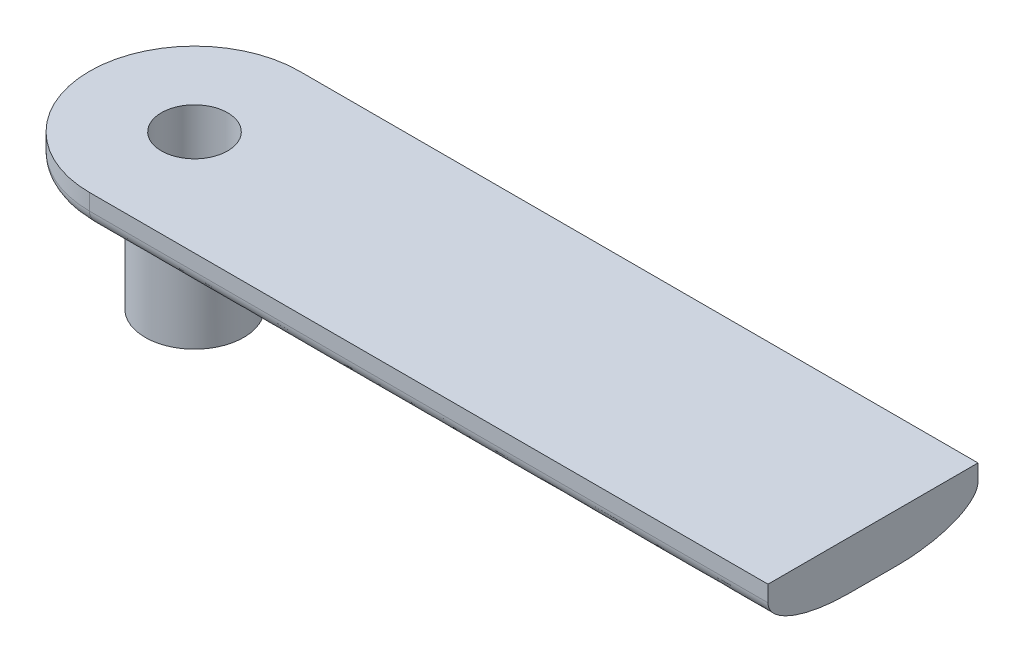
from build123d import *

# Parameters (mm, degrees)
BOSS_EXTRUDE1_DEPTH = 3
FILLET1_SIZE        = 2
FILLET1_SIZE_2      = 5
SKETCH2_R           = 3.05
SKETCH2_R_2         = 2.05
BOSS_EXTRUDE3_DEPTH = 9.5
SKETCH3_R           = 2.05
CUT_EXTRUDE1_DEPTH  = 44.548823309


with BuildPart() as part:
    # Sketch1 → Boss-Extrude1 (new body)
    with BuildSketch(Plane(origin=(0, 0, 0), x_dir=(1, 0, 0), z_dir=(0, 1, 0))):
        with BuildLine():
            Line((0, 6.5), (42, 6.5))
            Line((42, 6.5), (42, -6.5))
            Line((42, -6.5), (0, -6.5))
            ThreePointArc((0, -6.5), (-6.5, 0), (0, 6.5))
        make_face()
    extrude(amount=BOSS_EXTRUDE1_DEPTH)

    # Fillet1
    # an asymmetric fillet: 5, 2 mm, written as the material it takes off along each edge
    with BuildSketch(Plane(origin=(0, 0, -6.5), x_dir=(0, 1, 0), z_dir=(1, 0, 0)), Plane(origin=(54.5, 0, 6.5), x_dir=(0, 1, 0), z_dir=(-1, 0, 0))) as fillet1_piece_1:
        with BuildLine():
            Bezier((FILLET1_SIZE, 0), (0, 0), (0, FILLET1_SIZE_2), weights=[1, 0.707106781, 1])
            Line((0, FILLET1_SIZE_2), (0, 0))
            Line((0, 0), (FILLET1_SIZE, 0))
        make_face()
    extrude(amount=54.5, mode=Mode.SUBTRACT)
    with BuildSketch(Plane(origin=(0, 0, 0), x_dir=(0, 0, 1), z_dir=(1, 0, 0))) as fillet1_piece_2:
        with BuildLine():
            Bezier((6.5, -FILLET1_SIZE), (6.5, 0), (6.5 - FILLET1_SIZE_2, 0), weights=[1, 0.707106781, 1])
            Line((6.5 - FILLET1_SIZE_2, 0), (6.5, 0))
            Line((6.5, 0), (6.5, -FILLET1_SIZE))
        make_face()
    revolve(axis=Axis((0, 0, 0), (0, -1, 0)), revolution_arc=180, mode=Mode.SUBTRACT)

    # Sketch2 → Boss-Extrude3 (add)
    with BuildSketch(Plane(origin=(0, 3, 0), x_dir=(1, 0, 0), z_dir=(0, 1, 0))):
        with Locations(Location((0, 0, 0), (0, 0, 270))):
            Circle(SKETCH2_R)
        with Locations(Location((0, 0, 0), (0, 0, 270))):
            Circle(SKETCH2_R_2, mode=Mode.SUBTRACT)
    extrude(amount=-BOSS_EXTRUDE3_DEPTH)

    # Sketch3 → Cut-Extrude1 (cut, through all)
    with BuildSketch(Plane(origin=(0, 3, 0), x_dir=(1, 0, 0), z_dir=(0, 1, 0))):
        with Locations(Location((0, 0, 0), (0, 0, 270))):
            Circle(SKETCH3_R)
    extrude(amount=-CUT_EXTRUDE1_DEPTH, mode=Mode.SUBTRACT)


solid = part.part
